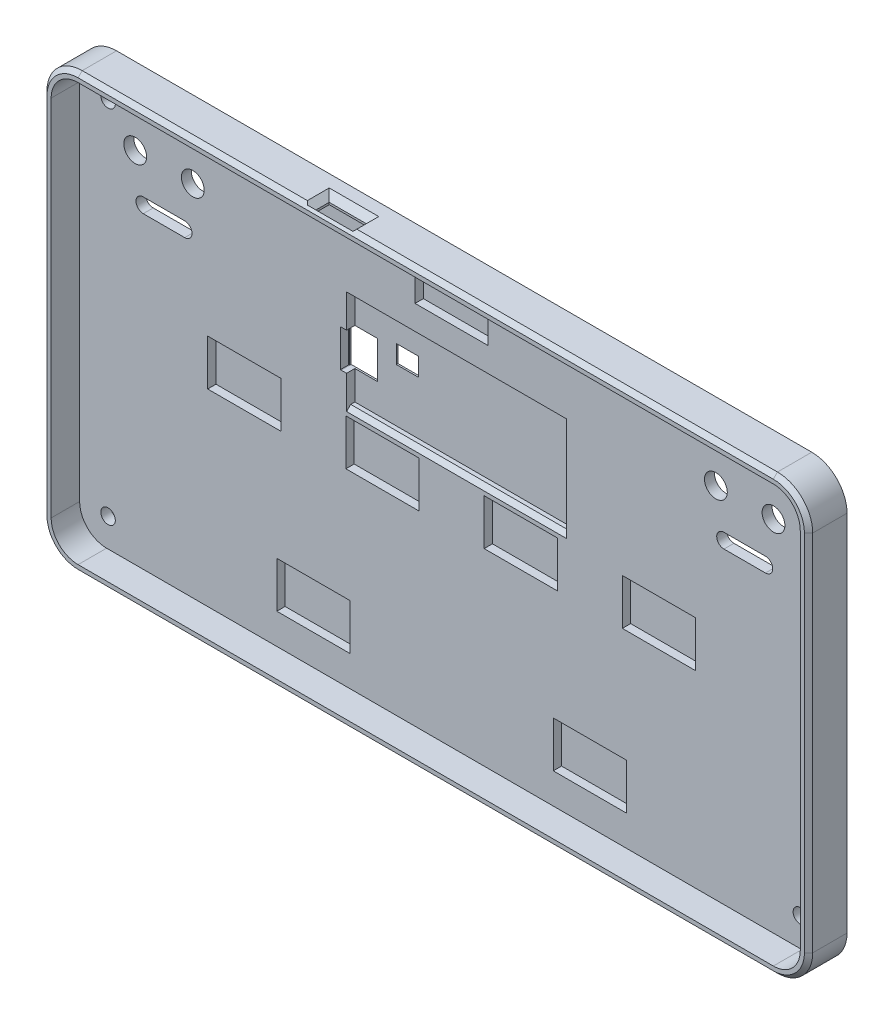
from build123d import *

# Parameters (mm, degrees)
SKETCH8_W                = 184.700046
SKETCH8_H                = 104.699952
SKETCH8_W_2              = 180.700046
SKETCH8_H_2              = 100.699952
BOSS_EXTRUDE1_DEPTH      = 6.875
BOSS_EXTRUDE2_START      = -2.4
BOSS_EXTRUDE2_OUTLINE_W  = 184.700046
BOSS_EXTRUDE2_OUTLINE_H  = 104.699952
BOSS_EXTRUDE2_DEPTH      = 2.4
FILLET1_R                = 6.5
FILLET2_R                = 8.5
CUT_EXTRUDE1_START       = -2.4
CUT_EXTRUDE1_OUTLINE_R   = 1.75
CUT_EXTRUDE1_OUTLINE_R_2 = 2.75
CUT_EXTRUDE1_DEPTH       = 2.4
SKETCH10_7_W             = 17.644114
SKETCH10_7_H             = 11.057386
SKETCH10_7_W_2           = 17.64386
CUT_EXTRUDE5_DEPTH       = 2
SKETCH10_5_W             = 52
SKETCH10_5_H             = 23
SKETCH10_5_W_2           = 1.5
SKETCH10_5_H_2           = 9
CUT_EXTRUDE2_DEPTH       = 2
SKETCH11_W               = 5.3
SKETCH11_H               = 4.4
SKETCH11_W_2             = 6.7
SKETCH11_H_2             = 9
CUT_EXTRUDE3_DEPTH       = 283.262347682
CUT_EXTRUDE4_REACH       = 262.478
SKETCH13_W               = 8.94
SKETCH13_H               = 3.21
CHAMFER1_SIZE            = 1


# Read off the part's stored shape, not the designer's step: Boss-Extrude2, Cut-Extrude1
with BuildPart() as part:
    # Sketch8 → Boss-Extrude1 (new body)
    with BuildSketch(Plane.XY):
        with Locations((146.060033, -98.469958)):
            Rectangle(SKETCH8_W, SKETCH8_H)
        with Locations((146.060033, -98.469958)):
            Rectangle(SKETCH8_W_2, SKETCH8_H_2, mode=Mode.SUBTRACT)
    extrude(amount=BOSS_EXTRUDE1_DEPTH)

    # Boss-Extrude2 outline → Boss-Extrude2 (add)
    with BuildSketch(Plane.XY.offset(BOSS_EXTRUDE2_START)):
        with Locations((146.060033, -98.469958)):
            Rectangle(BOSS_EXTRUDE2_OUTLINE_W, BOSS_EXTRUDE2_OUTLINE_H)
    extrude(amount=BOSS_EXTRUDE2_DEPTH)

    # Fillet1
    fillet1_edges = [part.edges().sort_by_distance(p)[0] for p in [
        (55.71001, -48.119982, 3.4375),
        (55.71001, -148.819934, 3.4375),
        (236.410056, -148.819934, 3.4375),
        (236.410056, -48.119982, 3.4375),
    ]]
    fillet(fillet1_edges, radius=FILLET1_R)

    # Fillet2
    fillet2_edges = [part.edges().sort_by_distance(p)[0] for p in [
        (53.71001, -46.119982, 2.2375),
        (238.410056, -46.119982, 2.2375),
        (238.410056, -150.819934, 2.2375),
        (53.71001, -150.819934, 2.2375),
    ]]
    fillet(fillet2_edges, radius=FILLET2_R)

    # Cut-Extrude1 outline → Cut-Extrude1 (cut)
    with BuildSketch(Plane.XY.offset(CUT_EXTRUDE1_START)):
        with BuildLine():
            ThreePointArc((211.129890659, -71.039941661), (209.379890659, -72.789941661), (211.129890659, -74.539941661))
            Line((211.129890659, -74.539941661), (221.129869217, -74.539956319))
            ThreePointArc((221.129869217, -74.539956319), (222.879869217, -72.789956319), (221.129869217, -71.039956319))
            Line((221.129869217, -71.039956319), (211.129890659, -71.039941661))
        make_face()
        with BuildLine():
            ThreePointArc((71.060056, -71.020026355), (69.310056, -72.770026355), (71.060056, -74.520026355))
            Line((71.060056, -74.520026355), (81.060031996, -74.520024697))
            ThreePointArc((81.060031996, -74.520024697), (82.810031996, -72.770024697), (81.060031996, -71.020024697))
            Line((81.060031996, -71.020024697), (71.060056, -71.020026355))
        make_face()
        with Locations((62.562867, -54.971021734)):
            Circle(CUT_EXTRUDE1_OUTLINE_R)
        with Locations((62.562261827, -141.970970853)):
            Circle(CUT_EXTRUDE1_OUTLINE_R)
        with Locations((229.562577334, -141.970520822)):
            Circle(CUT_EXTRUDE1_OUTLINE_R)
        with Locations((229.562626116, -54.970974994)):
            Circle(CUT_EXTRUDE1_OUTLINE_R)
        with Locations((69.109971, -62.269943649)):
            Circle(CUT_EXTRUDE1_OUTLINE_R_2)
        with Locations((83.009994, -62.269891837)):
            Circle(CUT_EXTRUDE1_OUTLINE_R_2)
        with Locations((223.079889236, -62.289981332)):
            Circle(CUT_EXTRUDE1_OUTLINE_R_2)
        with Locations((209.180049, -62.290009649)):
            Circle(CUT_EXTRUDE1_OUTLINE_R_2)
    extrude(amount=CUT_EXTRUDE1_DEPTH, mode=Mode.SUBTRACT)

    # Sketch10<7> → Cut-Extrude5 (cut)
    with BuildSketch(Plane.XY):
        with Locations((95.414973, -97.845245)):
            Rectangle(SKETCH10_7_W, SKETCH10_7_H)
        with Locations((128.755013, -97.845245)):
            Rectangle(SKETCH10_7_W, SKETCH10_7_H)
        with Locations((162.104959, -97.845245)):
            Rectangle(SKETCH10_7_W, SKETCH10_7_H)
        with Locations((195.434966, -97.845245)):
            Rectangle(SKETCH10_7_W_2, SKETCH10_7_H)
        with Locations((112.095026, -135.935085)):
            Rectangle(SKETCH10_7_W_2, SKETCH10_7_H)
        with Locations((178.774979, -135.935085)):
            Rectangle(SKETCH10_7_W, SKETCH10_7_H)
        with Locations((145.444972, -54.955313)):
            Rectangle(SKETCH10_7_W_2, SKETCH10_7_H)
    extrude(amount=-CUT_EXTRUDE5_DEPTH, mode=Mode.SUBTRACT)

    # Sketch10<5> → Cut-Extrude2 (cut)
    with BuildSketch(Plane.XY):
        with Locations((146.099911, -78.839949)):
            Rectangle(SKETCH10_5_W, SKETCH10_5_H)
        with Locations((119.349911, -78.839949)):
            Rectangle(SKETCH10_5_W_2, SKETCH10_5_H_2)
    extrude(amount=-CUT_EXTRUDE2_DEPTH, mode=Mode.SUBTRACT)

    # Sketch11 → Cut-Extrude3 (cut, through all)
    with BuildSketch(Plane(origin=(0, 0, -2.4), x_dir=(-1, 0, 0), z_dir=(0, 0, -1))):
        with Locations((-132.750038, -75.310076)):
            Rectangle(SKETCH11_W, SKETCH11_H)
        with Locations((-122.150038, -78.840076)):
            Rectangle(SKETCH11_W_2, SKETCH11_H_2)
    extrude(amount=-CUT_EXTRUDE3_DEPTH, mode=Mode.SUBTRACT)

    # Sketch13 → Cut-Extrude4 (cut, up to next)
    with BuildSketch(Plane(origin=(0, -46.119982, 0), x_dir=(1, 0, 0), z_dir=(0, 1, 0)), mode=Mode.PRIVATE) as cut_extrude4_sk1:
        with Locations((122.48388, -3.705)):
            Rectangle(SKETCH13_W, SKETCH13_H)
    cut_extrude4_tool1 = extrude(cut_extrude4_sk1.sketch, amount=-CUT_EXTRUDE4_REACH, mode=Mode.PRIVATE) & part.part
    add(cut_extrude4_tool1.solids().sort_by_distance((122.48388, -46.119982, 3.705))[0], mode=Mode.SUBTRACT)

    # Chamfer1
    chamfer1_edges = [part.edges().sort_by_distance(p)[0] for p in [
        (146.099911, -90.339949, 0),
        (146.099911, -67.339949, 0),
        (172.099911, -78.839949, 0),
        (238.410056, -98.469958, 6.875),
        (146.060033, -150.819934, 6.875),
        (53.71001, -98.469958, 6.875),
        (146.060033, -46.119982, 6.875),
        (56.19960236, -48.60957436, 6.875),
        (235.92046364, -48.60957436, 6.875),
        (56.19960236, -148.33034164, 6.875),
        (235.92046364, -148.33034164, 6.875),
    ]]
    chamfer(chamfer1_edges, length=CHAMFER1_SIZE)

    # Chamfer2
    # the kernel refuses this chamfer: 1.5 mm, written as the material it takes off along each edge
    with BuildSketch(Plane(origin=(118.01388, -46.119982, 5.31), x_dir=(0, 0.02749587661058678, 0.9996219169112968), z_dir=(1, 0, 0)), Plane(origin=(126.95388, -46.119982, 2.1), x_dir=(0, 0.027495876610586778, -0.9996219169112968), z_dir=(-1, 0, 0))) as chamfer2_piece_1:
        with BuildLine():
            Line((1.543009793, 0), (-0.084820732, 1.54067669))
            Line((-0.084820732, 1.54067669), (-0.11480939, 1.539851814))
            ThreePointArc((-0.11480939, 1.539851814), (-0.051193841, 0.770096744), (-0.029988658, -0.000824876))
            Line((-0.029988658, -0.000824876), (0.000824876, -0.029988658))
            ThreePointArc((0.000824876, -0.029988658), (0.771746497, -0.008783474), (1.543834669, -0.029988658))
            Line((1.543834669, -0.029988658), (1.543009793, 0))
        make_face()
    extrude(amount=8.94, mode=Mode.SUBTRACT)
    with BuildSketch(Plane(origin=(126.95388, -46.119982, 5.31), x_dir=(0.9996219169112968, 0.027495876610586893, 0), z_dir=(0, 0, -1)), Plane(origin=(118.01388, -46.119982, 2.1), x_dir=(-0.9996219169112968, 0.027495876610586893, 0), z_dir=(0, 0, 1))) as chamfer2_piece_2:
        with BuildLine():
            Line((1.543009793, 0), (-0.084820732, 1.54067669))
            Line((-0.084820732, 1.54067669), (-0.11480939, 1.539851814))
            ThreePointArc((-0.11480939, 1.539851814), (-0.051193841, 0.770096744), (-0.029988658, -0.000824876))
            Line((-0.029988658, -0.000824876), (0.000824876, -0.029988658))
            ThreePointArc((0.000824876, -0.029988658), (0.771746497, -0.008783474), (1.543834669, -0.029988658))
            Line((1.543834669, -0.029988658), (1.543009793, 0))
        make_face()
    extrude(amount=3.21, mode=Mode.SUBTRACT)
    with BuildSketch(Plane(origin=(118.01388, -46.119982, 2.1), x_dir=(-0.9996219169112968, 0.027495876610586893, 0), z_dir=(0, 0, 1))) as chamfer2_piece_3a_section:
        with BuildLine():
            Line((1.543009793, 0), (-0.084820732, 1.54067669))
            Line((-0.084820732, 1.54067669), (-0.11480939, 1.539851814))
            ThreePointArc((-0.11480939, 1.539851814), (-0.051193841, 0.770096744), (-0.029988658, -0.000824876))
            Line((-0.029988658, -0.000824876), (0.000824876, -0.029988658))
            ThreePointArc((0.000824876, -0.029988658), (0.771746497, -0.008783474), (1.543834669, -0.029988658))
            Line((1.543834669, -0.029988658), (1.543009793, 0))
        make_face()
    chamfer2_piece_3a = extrude(amount=7.067524482, mode=Mode.PRIVATE)
    chamfer2_piece_3a = split(chamfer2_piece_3a, bisect_by=Plane(origin=(117.51918956, -46.61467244, 5.31), z_dir=(0, 0, 1)), keep=Keep.TOP, mode=Mode.PRIVATE)
    with BuildSketch(Plane(origin=(114.156355518, -46.119982, 5.31), x_dir=(0, 0.02749587661058678, 0.9996219169112968), z_dir=(1, 0, 0))) as chamfer2_piece_3b_section:
        with BuildLine():
            Line((1.543009793, 0), (-0.084820732, 1.54067669))
            Line((-0.084820732, 1.54067669), (-0.11480939, 1.539851814))
            ThreePointArc((-0.11480939, 1.539851814), (-0.051193841, 0.770096744), (-0.029988658, -0.000824876))
            Line((-0.029988658, -0.000824876), (0.000824876, -0.029988658))
            ThreePointArc((0.000824876, -0.029988658), (0.771746497, -0.008783474), (1.543834669, -0.029988658))
            Line((1.543834669, -0.029988658), (1.543009793, 0))
        make_face()
    chamfer2_piece_3b = extrude(amount=12.797524482, mode=Mode.PRIVATE)
    chamfer2_piece_3b = split(chamfer2_piece_3b, bisect_by=Plane(origin=(118.01388, -46.61467244, 5.80469044), z_dir=(-1, 0, 0)), keep=Keep.TOP, mode=Mode.PRIVATE)
    chamfer2_piece_3 = chamfer2_piece_3a & chamfer2_piece_3b
    add(chamfer2_piece_3, mode=Mode.SUBTRACT)
    with BuildSketch(Plane(origin=(126.95388, -46.119982, 9.167524482), x_dir=(0.9996219169112968, 0.027495876610586893, 0), z_dir=(0, 0, -1))) as chamfer2_piece_4a_section:
        with BuildLine():
            Line((1.543009793, 0), (-0.084820732, 1.54067669))
            Line((-0.084820732, 1.54067669), (-0.11480939, 1.539851814))
            ThreePointArc((-0.11480939, 1.539851814), (-0.051193841, 0.770096744), (-0.029988658, -0.000824876))
            Line((-0.029988658, -0.000824876), (0.000824876, -0.029988658))
            ThreePointArc((0.000824876, -0.029988658), (0.771746497, -0.008783474), (1.543834669, -0.029988658))
            Line((1.543834669, -0.029988658), (1.543009793, 0))
        make_face()
    chamfer2_piece_4a = extrude(amount=7.067524482, mode=Mode.PRIVATE)
    chamfer2_piece_4a = split(chamfer2_piece_4a, bisect_by=Plane(origin=(127.44857044, -46.61467244, 5.31), z_dir=(0, 0, 1)), keep=Keep.TOP, mode=Mode.PRIVATE)
    with BuildSketch(Plane(origin=(118.01388, -46.119982, 5.31), x_dir=(0, 0.02749587661058678, 0.9996219169112968), z_dir=(1, 0, 0))) as chamfer2_piece_4b_section:
        with BuildLine():
            Line((1.543009793, 0), (-0.084820732, 1.54067669))
            Line((-0.084820732, 1.54067669), (-0.11480939, 1.539851814))
            ThreePointArc((-0.11480939, 1.539851814), (-0.051193841, 0.770096744), (-0.029988658, -0.000824876))
            Line((-0.029988658, -0.000824876), (0.000824876, -0.029988658))
            ThreePointArc((0.000824876, -0.029988658), (0.771746497, -0.008783474), (1.543834669, -0.029988658))
            Line((1.543834669, -0.029988658), (1.543009793, 0))
        make_face()
    chamfer2_piece_4b = extrude(amount=12.797524482, mode=Mode.PRIVATE)
    chamfer2_piece_4b = split(chamfer2_piece_4b, bisect_by=Plane(origin=(126.95388, -46.61467244, 5.80469044), z_dir=(1, 0, 0)), keep=Keep.TOP, mode=Mode.PRIVATE)
    chamfer2_piece_4 = chamfer2_piece_4a & chamfer2_piece_4b
    add(chamfer2_piece_4, mode=Mode.SUBTRACT)
    with BuildSketch(Plane(origin=(126.95388, -46.119982, 5.31), x_dir=(0.9996219169112968, 0.027495876610586893, 0), z_dir=(0, 0, -1))) as chamfer2_piece_5a_section:
        with BuildLine():
            Line((1.543009793, 0), (-0.084820732, 1.54067669))
            Line((-0.084820732, 1.54067669), (-0.11480939, 1.539851814))
            ThreePointArc((-0.11480939, 1.539851814), (-0.051193841, 0.770096744), (-0.029988658, -0.000824876))
            Line((-0.029988658, -0.000824876), (0.000824876, -0.029988658))
            ThreePointArc((0.000824876, -0.029988658), (0.771746497, -0.008783474), (1.543834669, -0.029988658))
            Line((1.543834669, -0.029988658), (1.543009793, 0))
        make_face()
    chamfer2_piece_5a = extrude(amount=7.067524482, mode=Mode.PRIVATE)
    chamfer2_piece_5a = split(chamfer2_piece_5a, bisect_by=Plane(origin=(127.44857044, -46.61467244, 2.1), z_dir=(0, 0, -1)), keep=Keep.TOP, mode=Mode.PRIVATE)
    with BuildSketch(Plane(origin=(130.811404482, -46.119982, 2.1), x_dir=(0, 0.027495876610586778, -0.9996219169112968), z_dir=(-1, 0, 0))) as chamfer2_piece_5b_section:
        with BuildLine():
            Line((1.543009793, 0), (-0.084820732, 1.54067669))
            Line((-0.084820732, 1.54067669), (-0.11480939, 1.539851814))
            ThreePointArc((-0.11480939, 1.539851814), (-0.051193841, 0.770096744), (-0.029988658, -0.000824876))
            Line((-0.029988658, -0.000824876), (0.000824876, -0.029988658))
            ThreePointArc((0.000824876, -0.029988658), (0.771746497, -0.008783474), (1.543834669, -0.029988658))
            Line((1.543834669, -0.029988658), (1.543009793, 0))
        make_face()
    chamfer2_piece_5b = extrude(amount=12.797524482, mode=Mode.PRIVATE)
    chamfer2_piece_5b = split(chamfer2_piece_5b, bisect_by=Plane(origin=(126.95388, -46.61467244, 1.60530956), z_dir=(1, 0, 0)), keep=Keep.TOP, mode=Mode.PRIVATE)
    chamfer2_piece_5 = chamfer2_piece_5a & chamfer2_piece_5b
    add(chamfer2_piece_5, mode=Mode.SUBTRACT)
    with BuildSketch(Plane(origin=(126.95388, -46.119982, 2.1), x_dir=(0, 0.027495876610586778, -0.9996219169112968), z_dir=(-1, 0, 0))) as chamfer2_piece_6a_section:
        with BuildLine():
            Line((1.543009793, 0), (-0.084820732, 1.54067669))
            Line((-0.084820732, 1.54067669), (-0.11480939, 1.539851814))
            ThreePointArc((-0.11480939, 1.539851814), (-0.051193841, 0.770096744), (-0.029988658, -0.000824876))
            Line((-0.029988658, -0.000824876), (0.000824876, -0.029988658))
            ThreePointArc((0.000824876, -0.029988658), (0.771746497, -0.008783474), (1.543834669, -0.029988658))
            Line((1.543834669, -0.029988658), (1.543009793, 0))
        make_face()
    chamfer2_piece_6a = extrude(amount=12.797524482, mode=Mode.PRIVATE)
    chamfer2_piece_6a = split(chamfer2_piece_6a, bisect_by=Plane(origin=(118.01388, -46.61467244, 1.60530956), z_dir=(-1, 0, 0)), keep=Keep.TOP, mode=Mode.PRIVATE)
    with BuildSketch(Plane(origin=(118.01388, -46.119982, -1.757524482), x_dir=(-0.9996219169112968, 0.027495876610586893, 0), z_dir=(0, 0, 1))) as chamfer2_piece_6b_section:
        with BuildLine():
            Line((1.543009793, 0), (-0.084820732, 1.54067669))
            Line((-0.084820732, 1.54067669), (-0.11480939, 1.539851814))
            ThreePointArc((-0.11480939, 1.539851814), (-0.051193841, 0.770096744), (-0.029988658, -0.000824876))
            Line((-0.029988658, -0.000824876), (0.000824876, -0.029988658))
            ThreePointArc((0.000824876, -0.029988658), (0.771746497, -0.008783474), (1.543834669, -0.029988658))
            Line((1.543834669, -0.029988658), (1.543009793, 0))
        make_face()
    chamfer2_piece_6b = extrude(amount=7.067524482, mode=Mode.PRIVATE)
    chamfer2_piece_6b = split(chamfer2_piece_6b, bisect_by=Plane(origin=(117.51918956, -46.61467244, 2.1), z_dir=(0, 0, -1)), keep=Keep.TOP, mode=Mode.PRIVATE)
    chamfer2_piece_6 = chamfer2_piece_6a & chamfer2_piece_6b
    add(chamfer2_piece_6, mode=Mode.SUBTRACT)


solid = part.part
